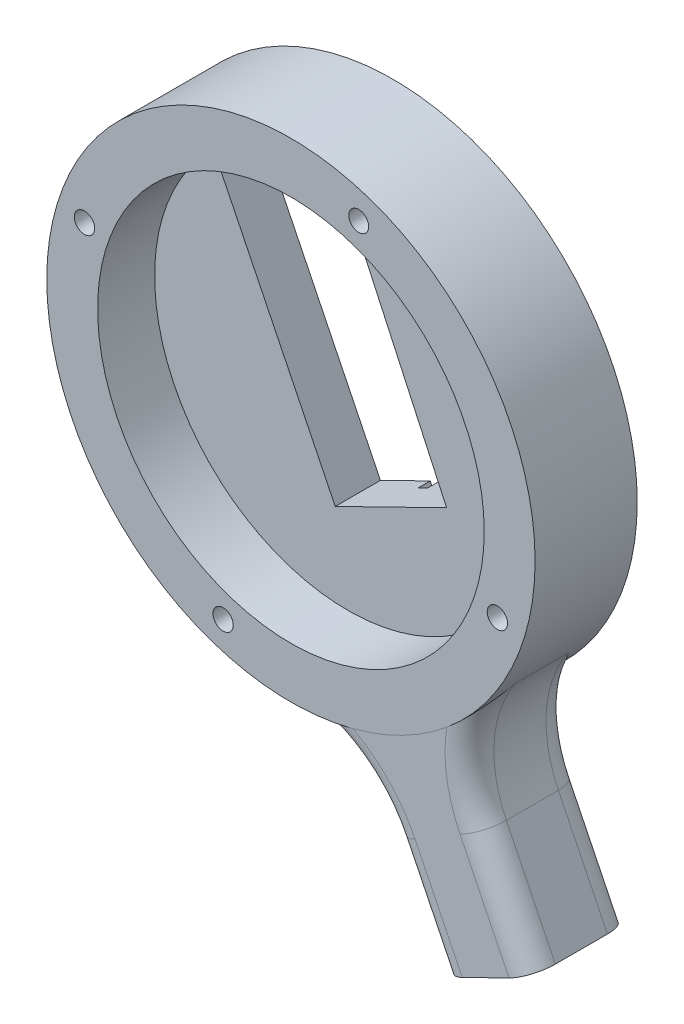
from build123d import *

# Parameters (mm, degrees)
SKETCH1_R                = 60
BOSS_EXTRUDE1_DEPTH      = 25.1
SKETCH3_R                = 47.5
CUT_EXTRUDE2_DEPTH       = 14
CUT_EXTRUDE5_DEPTH       = 89.487343728
CUT_EXTRUDE5_DEPTH_BACK  = 89.487343728
SKETCH2_R                = 2.494998654
SKETCH2_R_2              = 2.5
SKETCH2_R_3              = 2.444443829
SKETCH6_R                = 3
CUT_EXTRUDE6_DEPTH       = 6
CUT_EXTRUDE7_DEPTH       = 87
CUT_EXTRUDE7_DEPTH_BACK  = 87
BOSS_EXTRUDE2_DEPTH      = 30
BOSS_EXTRUDE2_DEPTH_BACK = 23
SKETCH8_W                = 24.8
SKETCH8_H                = 24.8
FILLET1_R                = 30
SKETCH9_R                = 6.1
CUT_EXTRUDE8_DEPTH       = 40
FILLET2_R                = 6
CUT_EXTRUDE9_DEPTH       = 3


with BuildPart() as part:
    # Sketch1 → Boss-Extrude1 (new body)
    with BuildSketch(Plane.XY):
        Circle(SKETCH1_R)
    extrude(amount=BOSS_EXTRUDE1_DEPTH)

    # Sketch3 → Cut-Extrude2 (cut)
    with BuildSketch(Plane.XY.offset(25.1)):
        Circle(SKETCH3_R)
    extrude(amount=-CUT_EXTRUDE2_DEPTH, mode=Mode.SUBTRACT)

    # Sketch2 → Cut-Extrude5 (cut, two sides: drawn at the far end of the back side and taken through both)
    with BuildSketch(Plane.XY.offset(25.1).offset(-CUT_EXTRUDE5_DEPTH_BACK)):
        with Locations((-16.664697145, -50.733104448)):
            Circle(SKETCH2_R)
        with Locations((-50.733105114, 16.664696544)):
            Circle(SKETCH2_R_2)
        with Locations((16.664695878, 50.733104512)):
            Circle(SKETCH2_R_3)
        with Locations((50.733103846, -16.66469648)):
            Circle(SKETCH2_R_2)
    extrude(amount=CUT_EXTRUDE5_DEPTH + CUT_EXTRUDE5_DEPTH_BACK, mode=Mode.SUBTRACT)

    # Sketch6 → Cut-Extrude6 (cut)
    with BuildSketch(Plane(origin=(0, 0, 0), x_dir=(-1, 0, 0), z_dir=(0, 0, -1))):
        with Locations((11.973502988, 47.212610548)):
            Circle(SKETCH6_R)
        with Locations((27.381285989, 40.029281029)):
            Circle(SKETCH6_R)
        with Locations((-19.717656658, -20.762902692)):
            Circle(SKETCH6_R)
        with Locations((-4.309873657, -27.946232212)):
            Circle(SKETCH6_R)
    extrude(amount=-CUT_EXTRUDE6_DEPTH, mode=Mode.SUBTRACT)

    # Sketch7 → Cut-Extrude7 (cut, two sides: drawn at the far end of the back side and taken through both)
    with BuildSketch(Plane.XY.offset(11.1).offset(-CUT_EXTRUDE7_DEPTH_BACK)):
        Polygon((-32.400942803, 32.871850778), (-3.10901045, -26.912408633), (24.254242539, -13.505492441), (-3.650778768, 46.958298756), align=None)
    extrude(amount=CUT_EXTRUDE7_DEPTH + CUT_EXTRUDE7_DEPTH_BACK, mode=Mode.SUBTRACT)

    # Sketch8 → Boss-Extrude2 (add, two sides: drawn at the far end of the back side and taken through both)
    with BuildSketch(Plane(origin=(33.53796733, -68.45033352, 0), x_dir=(-0.8980042769467113, -0.4399867254650012, 0), z_dir=(0.4399867254650012, -0.8980042769467113, 0)).offset(-BOSS_EXTRUDE2_DEPTH_BACK)):
        with Locations((-0.981202476, -12.478185074)):
            Rectangle(SKETCH8_W, SKETCH8_H)
    extrude(amount=BOSS_EXTRUDE2_DEPTH + BOSS_EXTRUDE2_DEPTH_BACK)

    # Fillet1
    fillet1_edges = [part.edges().sort_by_distance(p)[0] for p in [
        (37.75068654, -46.635669457, 12.478185074),
        (15.662587056, -57.91962851, 12.478185074),
    ]]
    fillet(fillet1_edges, radius=FILLET1_R)

    # Sketch9 → Cut-Extrude8 (cut)
    with BuildSketch(Plane(origin=(46.737569094, -95.390461829, 0), x_dir=(0.8980042769467111, 0.43998672546500134, 0), z_dir=(0.43998672546500134, -0.8980042769467111, 0))):
        with Locations((0.981202476, 12.478185074)):
            Circle(SKETCH9_R)
    extrude(amount=-CUT_EXTRUDE8_DEPTH, mode=Mode.SUBTRACT)

    # Fillet2
    # the kernel refuses this fillet: 6 mm, written as the material it takes off along each edge
    with BuildSketch(Plane(origin=(43.083240962, -113.884645314, 0.078185074), x_dir=(0.8980042769467113, 0.4399867254650012, 0), z_dir=(-0.43998672546500117, 0.8980042769467113, 0))) as fillet2_piece_1:
        with BuildLine():
            CenterArc((FILLET2_R, -FILLET2_R), FILLET2_R, 90, 90)
            Line((0, -FILLET2_R), (0, 0))
            Line((0, 0), (FILLET2_R, 0))
        make_face()
    extrude(amount=41.321991464, mode=Mode.SUBTRACT)
    with BuildSketch(Plane(origin=(43.083240962, -113.884645314, 24.878185074), x_dir=(0.8980042769467111, 0.4399867254650013, 0), z_dir=(-0.4399867254650013, 0.8980042769467113, 0))) as fillet2_piece_2:
        with BuildLine():
            CenterArc((FILLET2_R, FILLET2_R), FILLET2_R, 180, 90)
            Line((0, FILLET2_R), (0, 0))
            Line((0, 0), (FILLET2_R, 0))
        make_face()
    extrude(amount=41.321991464, mode=Mode.SUBTRACT)
    with BuildSketch(Plane(origin=(46.711419385, -64.924349442, 24.878185074), x_dir=(-0.8980042769467113, -0.4399867254650012, 0), z_dir=(0.4399867254650012, -0.8980042769467113, 0))) as fillet2_piece_3:
        with BuildLine():
            CenterArc((FILLET2_R, FILLET2_R), FILLET2_R, 180, 90)
            Line((0, FILLET2_R), (0, 0))
            Line((0, 0), (FILLET2_R, 0))
        make_face()
    extrude(amount=42.37020475, mode=Mode.SUBTRACT)
    with BuildSketch(Plane(origin=(46.711419385, -64.924349442, 0.078185074), x_dir=(-0.8980042769467113, -0.4399867254650012, 0), z_dir=(0.43998672546500117, -0.8980042769467113, 0))) as fillet2_piece_4:
        with BuildLine():
            CenterArc((FILLET2_R, -FILLET2_R), FILLET2_R, 90, 90)
            Line((0, -FILLET2_R), (0, 0))
            Line((0, 0), (FILLET2_R, 0))
        make_face()
    extrude(amount=42.37020475, mode=Mode.SUBTRACT)
    with BuildSketch(Plane(origin=(-2.03801506, -89.976922011, 24.878185074), x_dir=(-0.45951638072731243, 0.8881692945848058, 0), z_dir=(-0.8881692945848058, -0.45951638072731243, 0))) as fillet2_piece_5_section:
        with BuildLine():
            CenterArc((30 + FILLET2_R, FILLET2_R), FILLET2_R, 180, 90)
            Line((30, FILLET2_R), (30, 0))
            Line((30, 0), (30 + FILLET2_R, 0))
        make_face()
    fillet2_piece_5 = revolve(axis=Axis((-2.03801506, -89.976922011, 24.878185074), (0, 0, -1)), revolution_arc=91.252870665, mode=Mode.PRIVATE)
    fillet2_piece_5 = fillet2_piece_5 - Plane(origin=(0, 0, 24.878185074), x_dir=(1, 0, 0), z_dir=(0, 0, -1)) * Cylinder(60, 144, mode=Mode.PRIVATE)
    add(fillet2_piece_5, mode=Mode.SUBTRACT)
    with BuildSketch(Plane(origin=(-2.03801506, -89.976922011, 0.078185074), x_dir=(-0.45951638072731255, 0.8881692945848058, 0), z_dir=(-0.8881692945848058, -0.45951638072731255, 0))) as fillet2_piece_6_section:
        with BuildLine():
            CenterArc((30 + FILLET2_R, -FILLET2_R), FILLET2_R, 90, 90)
            Line((30 + FILLET2_R, 0), (30, 0))
            Line((30, 0), (30, -FILLET2_R))
        make_face()
    fillet2_piece_6 = revolve(axis=Axis((-2.03801506, -89.976922011, 0.078185074), (0, 0, -1)), revolution_arc=91.252870665, mode=Mode.PRIVATE)
    fillet2_piece_6 = fillet2_piece_6 - Plane(origin=(0, 0, 0.078185074), x_dir=(1, 0, 0), z_dir=(0, 0, -1)) * Cylinder(60, 144, mode=Mode.PRIVATE)
    add(fillet2_piece_6, mode=Mode.SUBTRACT)
    with BuildSketch(Plane(origin=(73.651547694, -51.724747678, 0.078185074), x_dir=(-0.44255176351936526, 0.8967429601652304, 0), z_dir=(0.8967429601652304, 0.44255176351936526, 0))) as fillet2_piece_7_section:
        with BuildLine():
            CenterArc((30 + FILLET2_R, FILLET2_R), FILLET2_R, 180, 90)
            Line((30 + FILLET2_R, 0), (30, 0))
            Line((30, 0), (30, FILLET2_R))
        make_face()
    fillet2_piece_7 = revolve(axis=Axis((73.651547694, -51.724747678, 0.078185074), (0, 0, 1)), revolution_arc=89.836226794, mode=Mode.PRIVATE)
    fillet2_piece_7 = fillet2_piece_7 - Plane(origin=(0, 0, 0.078185074), x_dir=(1, 0, 0), z_dir=(0, 0, -1)) * Cylinder(60, 144, mode=Mode.PRIVATE)
    add(fillet2_piece_7, mode=Mode.SUBTRACT)
    with BuildSketch(Plane(origin=(73.651547694, -51.724747678, 24.878185074), x_dir=(-0.44255176351936476, 0.8967429601652306, 0), z_dir=(0.8967429601652306, 0.44255176351936476, 0))) as fillet2_piece_8_section:
        with BuildLine():
            CenterArc((30 + FILLET2_R, -FILLET2_R), FILLET2_R, 90, 90)
            Line((30 + FILLET2_R, 0), (30, 0))
            Line((30, 0), (30, -FILLET2_R))
        make_face()
    fillet2_piece_8 = revolve(axis=Axis((73.651547694, -51.724747678, 24.878185074), (0, 0, 1)), revolution_arc=89.836226794, mode=Mode.PRIVATE)
    fillet2_piece_8 = fillet2_piece_8 - Plane(origin=(0, 0, 24.878185074), x_dir=(1, 0, 0), z_dir=(0, 0, -1)) * Cylinder(60, 144, mode=Mode.PRIVATE)
    add(fillet2_piece_8, mode=Mode.SUBTRACT)

    # Sketch12 → Cut-Extrude9 (cut)
    with BuildSketch(Plane(origin=(0, 0, 0), x_dir=(-1, 0, 0), z_dir=(0, 0, -1))):
        Polygon((16.569778792, 40.628497592), (19.583965842, 46.780394242), (22.182787305, 45.507074086), (19.168600256, 39.355177436), align=None)
        Polygon((-11.458078278, -19.775108918), (-14.390783054, -26.33846158), (-12.052056845, -27.383475291), (-9.156328603, -20.902875599), align=None)
    extrude(amount=-CUT_EXTRUDE9_DEPTH, mode=Mode.SUBTRACT)


solid = part.part
